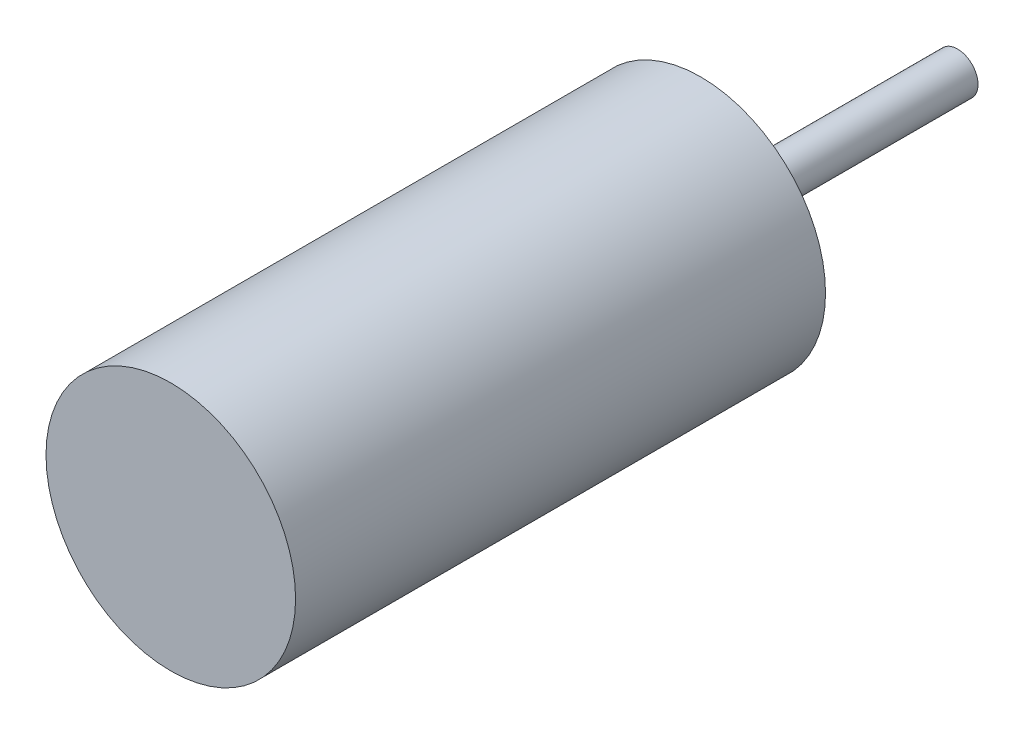
from build123d import *

# Parameters (mm, degrees)
SKETCH1_R           = 12.15
BOSS_EXTRUDE1_DEPTH = 51.6
SKETCH2_R           = 3.5
BOSS_EXTRUDE2_DEPTH = 2.4
SKETCH3_R           = 2
BOSS_EXTRUDE3_DEPTH = 22.6


with BuildPart() as part:
    # Sketch1 → Boss-Extrude1 (new body)
    with BuildSketch(Plane.XY):
        Circle(SKETCH1_R)
    extrude(amount=BOSS_EXTRUDE1_DEPTH)

    # Sketch2 → Boss-Extrude2 (add)
    with BuildSketch(Plane(origin=(0, 0, 0), x_dir=(-1, 0, 0), z_dir=(0, 0, -1))):
        Circle(SKETCH2_R)
    extrude(amount=BOSS_EXTRUDE2_DEPTH)

    # Sketch3 → Boss-Extrude3 (add)
    with BuildSketch(Plane(origin=(0, 0, -2.4), x_dir=(-1, 0, 0), z_dir=(0, 0, -1))):
        Circle(SKETCH3_R)
    extrude(amount=BOSS_EXTRUDE3_DEPTH)


solid = part.part
